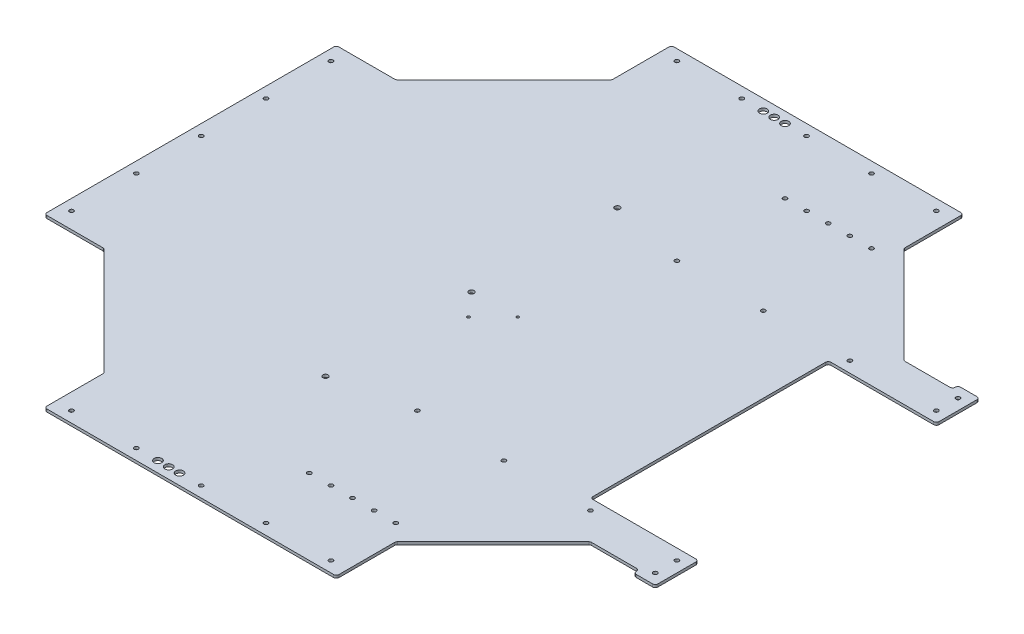
from build123d import *

# Parameters (mm, degrees)
SKETCH1_R           = 2.413
BOSS_EXTRUDE2_DEPTH = 3.175
FILLET2_R           = 3.175
SKETCH2_R           = 1.63195
CUT_EXTRUDE1_DEPTH  = 5.08
SKETCH3_R           = 4.445
CUT_EXTRUDE2_DEPTH  = 5.08
SKETCH8_R           = 3.048
CUT_EXTRUDE3_DEPTH  = 16.256


with BuildPart() as part:
    # Sketch1 → Boss-Extrude2 (new body)
    with BuildSketch(Plane(origin=(0, 0, 0), x_dir=(1, 0, 0), z_dir=(0, 1, 0))):
        Polygon((368.3, 139.7), (368.3, 190.500003027), (342.9, 190.500003027), (342.9, 184.150003027), (285.749996671, 184.150003027), (171.449996973, 298.45), (171.449996973, 368.3), (-171.450003027, 368.3), (-171.450003027, 298.45), (-298.45, 171.45), (-368.3, 171.45), (-368.3, -171.45), (-298.450006054, -171.45), (-171.450003027, -298.45), (-171.450003027, -368.3), (171.449996973, -368.3), (171.449996973, -298.45), (285.750002724, -184.149996973), (342.9, -184.149996973), (342.9, -190.499996973), (368.3, -190.499996973), (368.3, -139.7), (241.3, -139.7), (241.3, 139.7), align=None)
        with Locations(Location((-152.400003027, -355.6, 0), (0, 0, 270))):
            Circle(SKETCH1_R, mode=Mode.SUBTRACT)
        with Locations(Location((-76.200003027, -355.6, 0), (0, 0, 270))):
            Circle(SKETCH1_R, mode=Mode.SUBTRACT)
        with Locations(Location((-3.027e-06, -355.6, 0), (0, 0, 270))):
            Circle(SKETCH1_R, mode=Mode.SUBTRACT)
        with Locations(Location((-355.6, -152.4, 0), (0, 0, 270))):
            Circle(SKETCH1_R, mode=Mode.SUBTRACT)
        with Locations(Location((-355.6, -76.2, 0), (0, 0, 270))):
            Circle(SKETCH1_R, mode=Mode.SUBTRACT)
        with Locations(Location((76.199996973, -355.6, 0), (0, 0, 270))):
            Circle(SKETCH1_R, mode=Mode.SUBTRACT)
        with Locations(Location((50.8, -279.399996973, 0), (0, 0, 270))):
            Circle(SKETCH1_R, mode=Mode.SUBTRACT)
        with Locations(Location((76.2, -279.399996973, 0), (0, 0, 270))):
            Circle(SKETCH1_R, mode=Mode.SUBTRACT)
        with Locations(Location((152.399996973, -355.6, 0), (0, 0, 270))):
            Circle(SKETCH1_R, mode=Mode.SUBTRACT)
        with Locations(Location((101.6, -279.399996973, 0), (0, 0, 270))):
            Circle(SKETCH1_R, mode=Mode.SUBTRACT)
        with Locations(Location((127, -279.399996973, 0), (0, 0, 270))):
            Circle(SKETCH1_R, mode=Mode.SUBTRACT)
        with Locations(Location((152.4, -279.399996973, 0), (0, 0, 270))):
            Circle(SKETCH1_R, mode=Mode.SUBTRACT)
        with Locations(Location((50.8, -152.399996973, 0), (0, 0, 270))):
            Circle(SKETCH1_R, mode=Mode.SUBTRACT)
        with Locations(Location((152.4, -152.399996973, 0), (0, 0, 270))):
            Circle(SKETCH1_R, mode=Mode.SUBTRACT)
        with Locations(Location((254, -152.399996973, 0), (0, 0, 270))):
            Circle(SKETCH1_R, mode=Mode.SUBTRACT)
        with Locations(Location((355.6, -152.399996973, 0), (0, 0, 270))):
            Circle(SKETCH1_R, mode=Mode.SUBTRACT)
        with Locations(Location((-355.6, 0, 0), (0, 0, 270))):
            Circle(SKETCH1_R, mode=Mode.SUBTRACT)
        with Locations(Location((-355.6, 76.2, 0), (0, 0, 270))):
            Circle(SKETCH1_R, mode=Mode.SUBTRACT)
        with Locations(Location((-355.6, 152.4, 0), (0, 0, 270))):
            Circle(SKETCH1_R, mode=Mode.SUBTRACT)
        with Locations(Location((-152.4, 355.6, 0), (0, 0, 270))):
            Circle(SKETCH1_R, mode=Mode.SUBTRACT)
        with Locations(Location((-76.2, 355.6, 0), (0, 0, 270))):
            Circle(SKETCH1_R, mode=Mode.SUBTRACT)
        with Locations(Location((0, 355.6, 0), (0, 0, 270))):
            Circle(SKETCH1_R, mode=Mode.SUBTRACT)
        with Locations(Location((50.8, 152.400003027, 0), (0, 0, 270))):
            Circle(SKETCH1_R, mode=Mode.SUBTRACT)
        with Locations(Location((152.4, 152.400003027, 0), (0, 0, 270))):
            Circle(SKETCH1_R, mode=Mode.SUBTRACT)
        with Locations(Location((254, 152.400003027, 0), (0, 0, 270))):
            Circle(SKETCH1_R, mode=Mode.SUBTRACT)
        with Locations(Location((355.6, 152.400003027, 0), (0, 0, 270))):
            Circle(SKETCH1_R, mode=Mode.SUBTRACT)
        with Locations(Location((50.8, 279.400003027, 0), (0, 0, 270))):
            Circle(SKETCH1_R, mode=Mode.SUBTRACT)
        with Locations(Location((76.2, 279.400003027, 0), (0, 0, 270))):
            Circle(SKETCH1_R, mode=Mode.SUBTRACT)
        with Locations(Location((76.2, 355.6, 0), (0, 0, 270))):
            Circle(SKETCH1_R, mode=Mode.SUBTRACT)
        with Locations(Location((101.6, 279.400003027, 0), (0, 0, 270))):
            Circle(SKETCH1_R, mode=Mode.SUBTRACT)
        with Locations(Location((127, 279.400003027, 0), (0, 0, 270))):
            Circle(SKETCH1_R, mode=Mode.SUBTRACT)
        with Locations(Location((152.4, 279.400003027, 0), (0, 0, 270))):
            Circle(SKETCH1_R, mode=Mode.SUBTRACT)
        with Locations(Location((152.4, 355.6, 0), (0, 0, 270))):
            Circle(SKETCH1_R, mode=Mode.SUBTRACT)
        with Locations(Location((355.6, 177.800003027, 0), (0, 0, 270))):
            Circle(SKETCH1_R, mode=Mode.SUBTRACT)
        with Locations(Location((355.6, -177.799996973, 0), (0, 0, 270))):
            Circle(SKETCH1_R, mode=Mode.SUBTRACT)
    extrude(amount=BOSS_EXTRUDE2_DEPTH)

    # Fillet2
    fillet2_edges = [part.edges().sort_by_distance(p)[0] for p in [
        (171.449996973, 1.5875, 298.45),
        (-171.450003027, 1.5875, 368.3),
        (-171.450003027, 1.5875, 298.45),
        (-298.450006054, 1.5875, 171.45),
        (-368.3, 1.5875, 171.45),
        (-368.3, 1.5875, -171.45),
        (-298.45, 1.5875, -171.45),
        (-171.450003027, 1.5875, -298.45),
        (-171.450003027, 1.5875, -368.3),
        (171.449996973, 1.5875, -368.3),
        (171.449996973, 1.5875, -298.45),
        (171.449996973, 1.5875, 368.3),
        (241.3, 1.5875, 139.7),
        (368.3, 1.5875, 139.7),
        (285.750002724, 1.5875, 184.149996973),
        (285.749996671, 1.5875, -184.150003027),
        (368.3, 1.5875, -139.7),
        (241.3, 1.5875, -139.7),
        (342.9, 1.5875, 190.499996973),
        (342.9, 1.5875, 184.149996973),
        (342.9, 1.5875, -184.150003027),
        (342.9, 1.5875, -190.500003027),
        (368.3, 1.5875, -190.500003027),
        (368.3, 1.5875, 190.499996973),
    ]]
    fillet(fillet2_edges, radius=FILLET2_R - 0.0001)  # a hair under: the kernel refuses the full size

    # Sketch2 → Cut-Extrude1 (cut)
    with BuildSketch(Plane(origin=(0, 3.175, 0), x_dir=(1, 0, 0), z_dir=(0, 1, 0))):
        with Locations(Location((14.478, 1.778, 0), (0, 0, 270))):
            Circle(SKETCH2_R)
        with Locations(Location((-14.478, -27.178, 0), (0, 0, 270))):
            Circle(SKETCH2_R)
    extrude(amount=-CUT_EXTRUDE1_DEPTH, mode=Mode.SUBTRACT)

    # Sketch3 → Cut-Extrude2 (cut)
    with BuildSketch(Plane.XZ):
        with Locations(Location((-25.4, -355.6, 0), (0, 0, 270))):
            Circle(SKETCH3_R)
        with Locations(Location((-38.1, -355.6, 0), (0, 0, 270))):
            Circle(SKETCH3_R)
        with Locations(Location((-50.8, -355.6, 0), (0, 0, 270))):
            Circle(SKETCH3_R)
        with Locations(Location((-50.8, 355.6, 0), (0, 0, 90))):
            Circle(SKETCH3_R)
        with Locations(Location((-38.1, 355.6, 0), (0, 0, 90))):
            Circle(SKETCH3_R)
        with Locations(Location((-25.4, 355.6, 0), (0, 0, 90))):
            Circle(SKETCH3_R)
    extrude(amount=-CUT_EXTRUDE2_DEPTH, mode=Mode.SUBTRACT)

    # Sketch8 → Cut-Extrude3 (cut)
    with BuildSketch(Plane(origin=(0, 3.175, 0), x_dir=(1, 0, 0), z_dir=(0, 1, 0))):
        with Locations(Location((-38.1, -171.45, 0), (0, 0, 270))):
            Circle(SKETCH8_R)
        with Locations(Location((-38.1, 171.45, 0), (0, 0, 270))):
            Circle(SKETCH8_R)
        with Locations(Location((-38.1, 0, 0), (0, 0, 270))):
            Circle(SKETCH8_R)
    extrude(amount=-CUT_EXTRUDE3_DEPTH, mode=Mode.SUBTRACT)


solid = part.part
